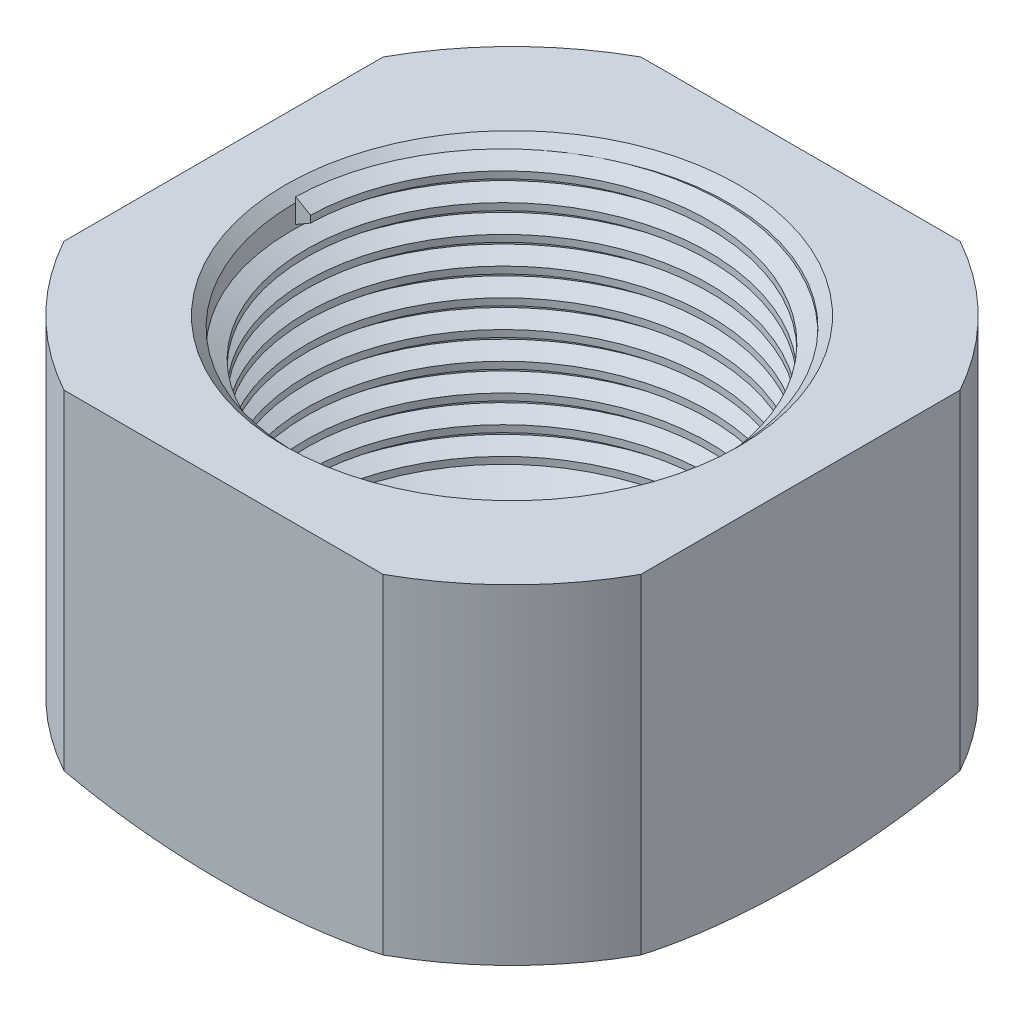
from build123d import *

# Parameters (mm, degrees)
CHAMFER1_SIZE      = 0.79375
THREAD1_PITCH      = 2.116666667
CUT_EXTRUDE1_DEPTH = 46.900442709
CIRPATTERN1_COUNT  = 4


with BuildPart() as part:
    # Sketch1 → Revolve1 (revolve)
    with BuildSketch(Plane.XY, mode=Mode.PRIVATE) as revolve1_sk:
        with BuildLine():
            Line((25.4, 28.575), (16.66875, 28.575))
            Line((16.66875, 28.575), (16.66875, 7.361934691))
            Line((16.66875, 7.361934691), (11.1125, 3.175))
            Line((11.1125, 3.175), (11.1125, 0))
            ThreePointArc((11.1125, 0), (18.430513413, 0.803314642), (25.4, 3.175))
            Line((25.4, 3.175), (25.4, 28.575))
        make_face()
    revolve(revolve1_sk.sketch.rotate(Axis((0, 53.46364703, 0), (0, -1, 0)), 180), axis=Axis((0, 53.46364703, 0), (0, -1, 0)))

    # Chamfer1
    chamfer1_edges = [part.edges().sort_by_distance(p)[0] for p in [
        (16.66875, 28.575, 0),
    ]]
    chamfer(chamfer1_edges, length=CHAMFER1_SIZE)

    # Thread1: the profile of Thread Profile2 profile screwed along a right-hand helix of 9.6 turns, 10 arcs to a turn; built about Z, then put on its axis
    thread1_z = Axis((0, 0, 0), (0, 0, 1))
    thread1_corners = [(16.66905, 0, -0.000173205), (16.66905, 0, 1.852256533), (15.523070565, 0, 1.190624997), (15.523070565, 0, 0.66145833)]
    with BuildLine(mode=Mode.PRIVATE) as thread1_profile:
        Line(thread1_corners[0], thread1_corners[1])
        Line(thread1_corners[1], thread1_corners[2])
        Line(thread1_corners[2], thread1_corners[3])
        Line(thread1_corners[3], thread1_corners[0])
    thread1_cap = Face(thread1_profile.wire())
    thread1_turn_angles = [0, 18, 36, 54, 72, 90, 108, 126, 144, 162, 180, 198, 216, 234, 252, 270, 288, 306, 324, 342, 360]
    thread1_turn_weights = [1, 0.9510565162951535, 1, 0.9510565162951535, 1, 0.9510565162951535, 1, 0.9510565162951535, 1, 0.9510565162951535, 1, 0.9510565162951535, 1, 0.9510565162951535, 1, 0.9510565162951535, 1, 0.9510565162951535, 1, 0.9510565162951535, 1]
    thread1_turn_rails = [Edge.make_bspline([Vector(p[0], p[1], 0).rotate(thread1_z, thread1_turn_angles[k]) / thread1_turn_weights[k] + Vector(0, 0, p[2] + THREAD1_PITCH * thread1_turn_angles[k] / 360) for k in range(21)], [0, 0, 0, 1, 1, 2, 2, 3, 3, 4, 4, 5, 5, 6, 6, 7, 7, 8, 8, 9, 9, 10, 10, 10], 2, thread1_turn_weights) for p in thread1_corners]
    thread1_turn_sides = [Face.make_surface_from_curves(thread1_turn_rails[p[0]], thread1_turn_rails[p[1]]) for p in [(0, 1), (1, 2), (2, 3), (3, 0)]]
    thread1_last_angles = [3240, 3258, 3276, 3294, 3312, 3330, 3348, 3366, 3384, 3402, 3420, 3438, 3456]
    thread1_last_weights = [1, 0.9510565162951535, 1, 0.9510565162951535, 1, 0.9510565162951535, 1, 0.9510565162951535, 1, 0.9510565162951535, 1, 0.9510565162951535, 1]
    thread1_last_rails = [Edge.make_bspline([Vector(p[0], p[1], 0).rotate(thread1_z, thread1_last_angles[k]) / thread1_last_weights[k] + Vector(0, 0, p[2] + THREAD1_PITCH * thread1_last_angles[k] / 360) for k in range(13)], [0, 0, 0, 1, 1, 2, 2, 3, 3, 4, 4, 5, 5, 6, 6, 6], 2, thread1_last_weights) for p in thread1_corners]
    thread1_last_sides = [Face.make_surface_from_curves(thread1_last_rails[p[0]], thread1_last_rails[p[1]]) for p in [(0, 1), (1, 2), (2, 3), (3, 0)]]
    thread1 = Plane(origin=(0, 28.178125, 0), x_dir=(-1, 0, 0), z_dir=(0, -1, 0)) * Solid(Shell([*[p.moved(Location((0, 0, THREAD1_PITCH * i))) for i in range(9) for p in thread1_turn_sides], *thread1_last_sides, thread1_cap, thread1_cap.rotate(thread1_z, 3456).moved(Location((0, 0, THREAD1_PITCH * 3456 / 360)))]))
    add(thread1)

    # Sketch8 → Cut-Extrude1 (cut, through all)
    with BuildSketch(Plane(origin=(0, 28.575, 0), x_dir=(1, 0, 0), z_dir=(0, 1, 0))):
        with BuildLine():
            Line((-22.225, 12.296722124), (-22.225, -12.296722124))
            ThreePointArc((-22.225, -12.296722124), (-25.4, 0), (-22.225, 12.296722124))
        make_face()
    cut_extrude1 = extrude(amount=-CUT_EXTRUDE1_DEPTH, mode=Mode.SUBTRACT)

    # CirPattern1: Cut-Extrude1 ×4 about axis
    cirpattern1_axis = Axis((0, 0, 0), (0, 1, 0))
    for i in range(1, CIRPATTERN1_COUNT):
        add(cut_extrude1.rotate(cirpattern1_axis, i * 360 / CIRPATTERN1_COUNT), mode=Mode.SUBTRACT)


solid = part.part
